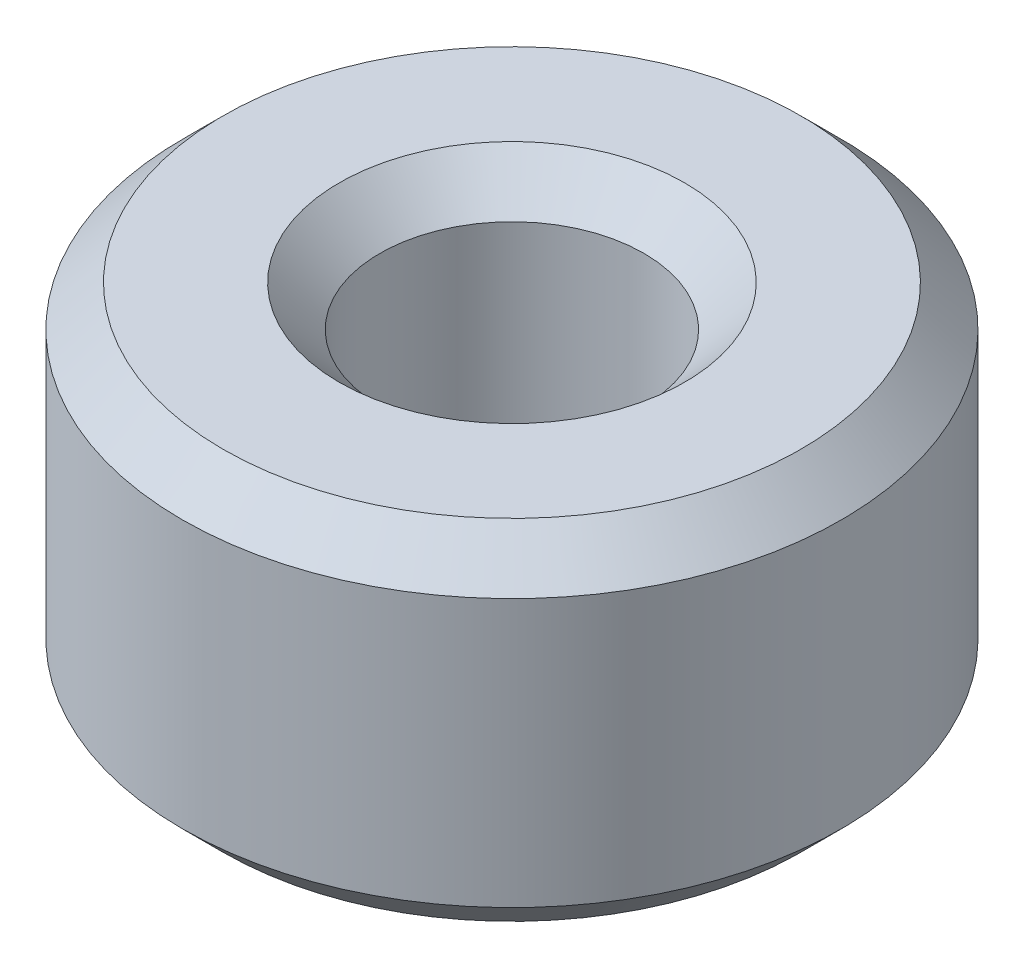
from build123d import *

# Parameters (mm, degrees)
SKETCH1_R           = 17.5
BOSS_EXTRUDE1_DEPTH = 18.531024009
SKETCH2_R           = 7.011577142
CUT_EXTRUDE1_DEPTH  = 31.917613925
CHAMFER1_SIZE       = 2.161688221


with BuildPart() as part:
    # Sketch1 → Boss-Extrude1 (new body)
    with BuildSketch(Plane(origin=(0, 0, 0), x_dir=(1, 0, 0), z_dir=(0, 1, 0))):
        Circle(SKETCH1_R)
    extrude(amount=BOSS_EXTRUDE1_DEPTH)

    # Sketch2 → Cut-Extrude1 (cut, through all)
    with BuildSketch(Plane(origin=(0, 0, 0), x_dir=(1, 0, 0), z_dir=(0, 1, 0))):
        Circle(SKETCH2_R)
    extrude(amount=CUT_EXTRUDE1_DEPTH, mode=Mode.SUBTRACT)

    # Chamfer1
    chamfer1_edges = [part.edges().sort_by_distance(p)[0] for p in [
        (-7.011577142, 18.531024009, 0),
        (-7.011577142, 0, 0),
        (-17.5, 0, 0),
        (-17.5, 18.531024009, 0),
    ]]
    chamfer(chamfer1_edges, length=CHAMFER1_SIZE)


solid = part.part
